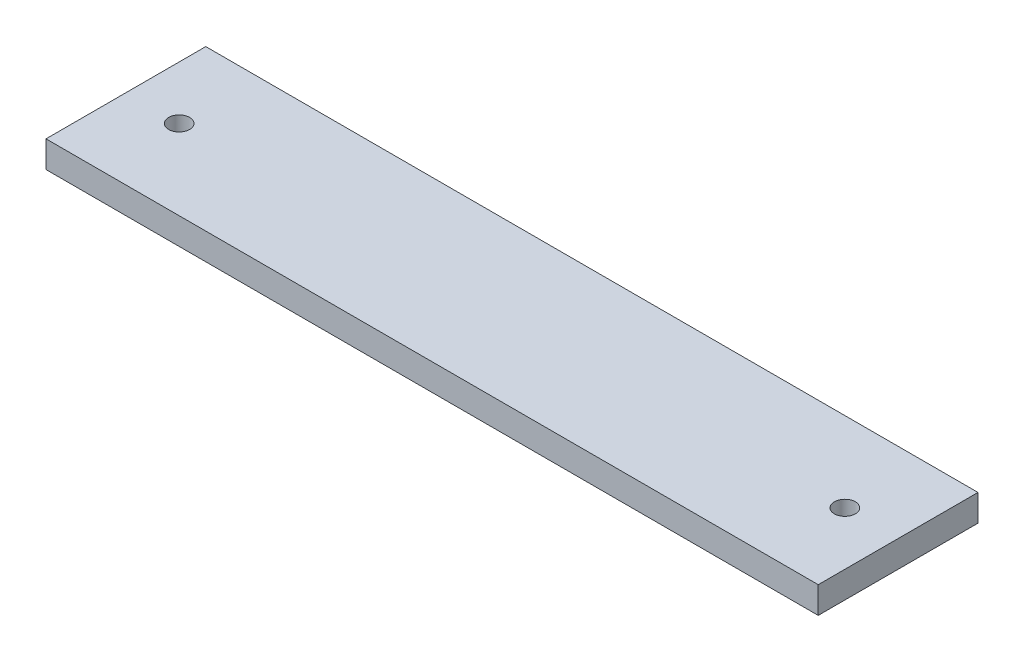
from build123d import *

# Parameters (mm, degrees)
SKETCH1_R           = 2.5
BOSS_EXTRUDE1_DEPTH = 6.35


with BuildPart() as part:
    # Sketch1 → Boss-Extrude1 (new body)
    with BuildSketch(Plane(origin=(0, 0, 0), x_dir=(1, 0, 0), z_dir=(0, 1, 0))):
        Polygon((0, 38.1), (0, 19.05), (0, 0), (184.15, 0), (184.15, 19.05), (184.15, 38.1), align=None)
        with BuildLine():
            ThreePointArc((15.2, 19.05), (12.7, 16.55), (10.2, 19.05))
            ThreePointArc((10.2, 19.05), (12.7, 21.55), (15.2, 19.05))
        make_face(mode=Mode.SUBTRACT)
        with Locations((171.45, 19.05)):
            Circle(SKETCH1_R, mode=Mode.SUBTRACT)
    extrude(amount=BOSS_EXTRUDE1_DEPTH)


solid = part.part
